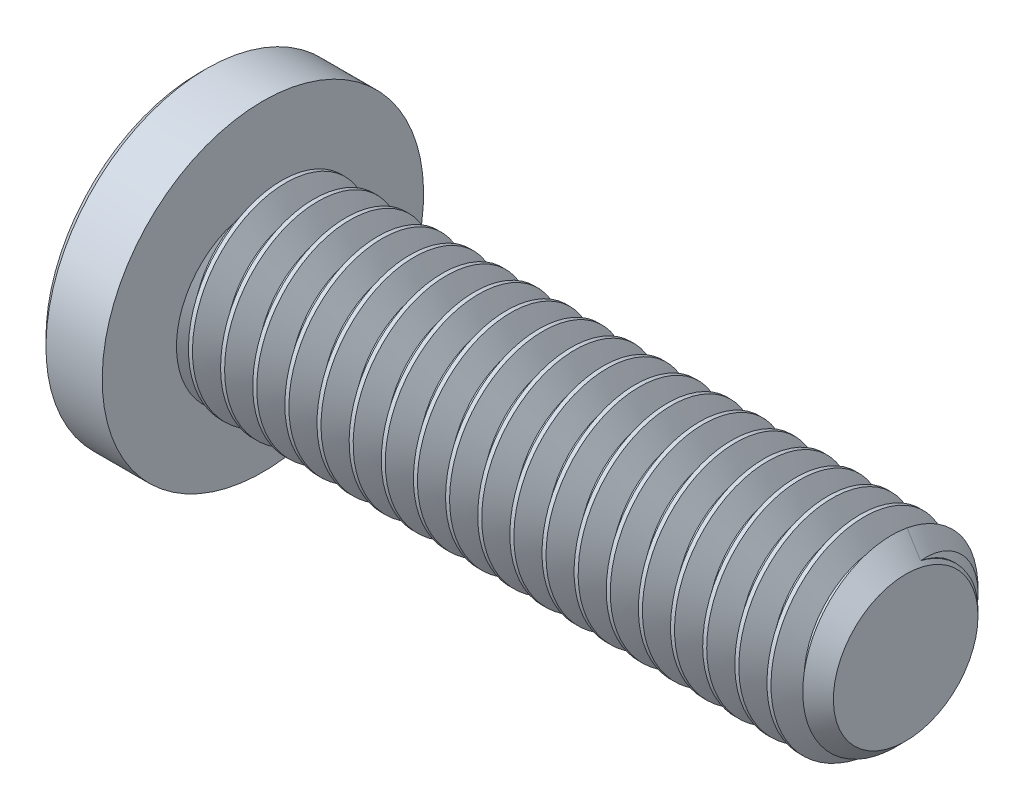
from build123d import *

# Parameters (mm, degrees)
SKETCH2_R           = 3
BOSS_EXTRUDE1_DEPTH = 20
CHAMFER1_SIZE       = 0.75
CUT_SWEEP1_PITCH    = 1
CUT_EXTRUDE1_DEPTH  = 3.12


with BuildPart() as part:
    # Sketch2 → Boss-Extrude1 (new body)
    with BuildSketch(Plane(origin=(10, 0, 0), x_dir=(0, 0, -1), z_dir=(1, 0, 0))):
        Circle(SKETCH2_R)
    extrude(amount=-BOSS_EXTRUDE1_DEPTH)

    # Chamfer1
    chamfer1_edges = [part.edges().sort_by_distance(p)[0] for p in [
        (10, 0, 3),
    ]]
    chamfer(chamfer1_edges, length=CHAMFER1_SIZE)

    # Cut-Sweep1: the profile of Sketch5 profile screwed along a right-hand helix of 21 turns, 8 arcs to a turn; built about Z, then put on its axis
    cut_sweep1_z = Axis((0, 0, 0), (0, 0, 1))
    cut_sweep1_corners = [(3.0003, 0, 0.437673205), (3.0003, 0, -0.437673205), (2.350480947, 0, -0.0625), (2.350480947, 0, 0.0625)]
    with BuildLine(mode=Mode.PRIVATE) as cut_sweep1_profile:
        Line(cut_sweep1_corners[0], cut_sweep1_corners[1])
        Line(cut_sweep1_corners[1], cut_sweep1_corners[2])
        Line(cut_sweep1_corners[2], cut_sweep1_corners[3])
        Line(cut_sweep1_corners[3], cut_sweep1_corners[0])
    cut_sweep1_cap = Face(cut_sweep1_profile.wire())
    cut_sweep1_turn_angles = [0, 22.5, 45, 67.5, 90, 112.5, 135, 157.5, 180, 202.5, 225, 247.5, 270, 292.5, 315, 337.5, 360]
    cut_sweep1_turn_weights = [1, 0.9238795325112867, 1, 0.9238795325112867, 1, 0.9238795325112867, 1, 0.9238795325112867, 1, 0.9238795325112867, 1, 0.9238795325112867, 1, 0.9238795325112867, 1, 0.9238795325112867, 1]
    cut_sweep1_turn_rails = [Edge.make_bspline([Vector(p[0], p[1], 0).rotate(cut_sweep1_z, cut_sweep1_turn_angles[k]) / cut_sweep1_turn_weights[k] + Vector(0, 0, p[2] + CUT_SWEEP1_PITCH * cut_sweep1_turn_angles[k] / 360) for k in range(17)], [0, 0, 0, 1, 1, 2, 2, 3, 3, 4, 4, 5, 5, 6, 6, 7, 7, 8, 8, 8], 2, cut_sweep1_turn_weights) for p in cut_sweep1_corners]
    cut_sweep1_turn_sides = [Face.make_surface_from_curves(cut_sweep1_turn_rails[p[0]], cut_sweep1_turn_rails[p[1]]) for p in [(0, 1), (1, 2), (2, 3), (3, 0)]]
    cut_sweep1 = Plane(origin=(10, 0, 0), x_dir=(0, 1, 0), z_dir=(-1, 0, 0)) * Solid(Shell([*[p.moved(Location((0, 0, CUT_SWEEP1_PITCH * i))) for i in range(21) for p in cut_sweep1_turn_sides], cut_sweep1_cap, cut_sweep1_cap.rotate(cut_sweep1_z, 7560).moved(Location((0, 0, CUT_SWEEP1_PITCH * 7560 / 360)))]))
    add(cut_sweep1, mode=Mode.SUBTRACT)

    # Sketch6 → Revolve1 (revolve)
    with BuildSketch(Plane.XY, mode=Mode.PRIVATE) as revolve1_sk:
        Polygon((-11.75, 5), (-12, 4.75), (-12, 0), (-10, 0), (-10, 5), align=None)
    revolve(revolve1_sk.sketch.rotate(Axis((-10, 0, 0), (-1, 0, 0)), 13.865622854), axis=Axis((-10, 0, 0), (-1, 0, 0)))

    # Sketch4 → Cut-Extrude1 (cut)
    with BuildSketch(Plane(origin=(-12, 0, 0), x_dir=(0, 0, -1), z_dir=(1, 0, 0))):
        Polygon((0, 2.309401077), (-2, 1.154700538), (-2, -1.154700538), (0, -2.309401077), (2, -1.154700538), (2, 1.154700538), align=None)
    extrude(amount=CUT_EXTRUDE1_DEPTH, mode=Mode.SUBTRACT)

    # Cut-Extrude2 cone 1 section (through the dimple's axis) → Cut-Extrude2 (revolve, cut)
    with BuildSketch(Plane(origin=(-12, 0, 0), x_dir=(0, 0, 1), z_dir=(0, 1, 0))):
        Polygon((0, 0), (2.309401077, 0), (0, 2.309401077), align=None)
    revolve(axis=Axis((-12, 0, 0), (1, 0, 0)), mode=Mode.SUBTRACT)


solid = part.part
